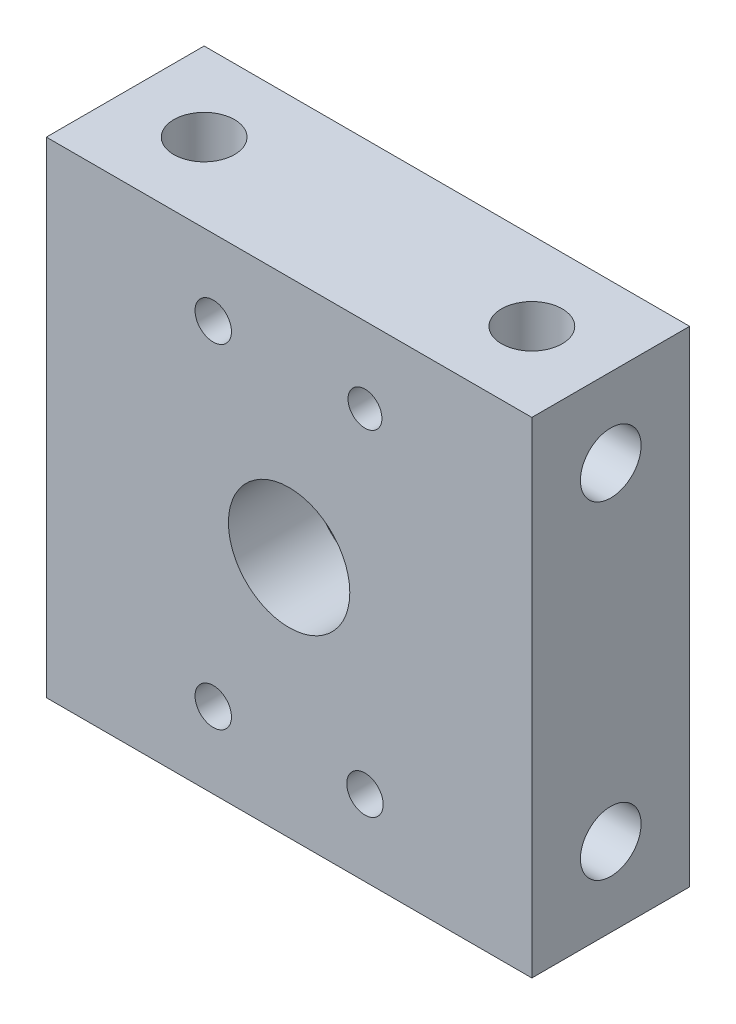
from build123d import *

# Parameters (mm, degrees)
SKETCH1_W           = 40
SKETCH1_H           = 40
SKETCH1_R           = 0.9
BOSS_EXTRUDE1_DEPTH = 6
SKETCH11_W          = 40
SKETCH11_H          = 40
SKETCH11_R          = 5
BOSS_EXTRUDE6_DEPTH = 7
SKETCH13_R          = 1.5
SKETCH13_R_2        = 1.395390764
CUT_EXTRUDE5_DEPTH  = 27
SKETCH13_3_R        = 3
SKETCH13_3_R_2      = 1.5
CUT_EXTRUDE6_DEPTH  = 3
SKETCH15_R          = 2.5
CUT_EXTRUDE9_DEPTH  = 5
CIRPATTERN4_COUNT   = 4


with BuildPart() as part:
    # Sketch1 → Boss-Extrude1 (new body)
    with BuildSketch(Plane(origin=(0, 0, 0), x_dir=(0, 1, 0), z_dir=(0, 0, 1))):
        Rectangle(SKETCH1_W, SKETCH1_H)
        Polygon((-5, -5), (-5, 5), (5, 5), (5, -5), (5, -13), (-5, -13), (-8, -13), (-8, -5), align=None, mode=Mode.SUBTRACT)
        with Locations((10.5, 0)):
            Circle(SKETCH1_R, mode=Mode.SUBTRACT)
        with Locations((-10.5, 0)):
            Circle(SKETCH1_R, mode=Mode.SUBTRACT)
        with Locations((-10.5, 12.5)):
            Circle(SKETCH1_R, mode=Mode.SUBTRACT)
        with Locations((10.5, 12.5)):
            Circle(SKETCH1_R, mode=Mode.SUBTRACT)
    extrude(amount=BOSS_EXTRUDE1_DEPTH)

    # Sketch11 → Boss-Extrude6 (add)
    with BuildSketch(Plane.XY.offset(6)):
        Rectangle(SKETCH11_W, SKETCH11_H)
        Circle(SKETCH11_R, mode=Mode.SUBTRACT)
    extrude(amount=BOSS_EXTRUDE6_DEPTH)

    # Sketch13 → Cut-Extrude5 (cut)
    with BuildSketch(Plane(origin=(0, 0, 0), x_dir=(1, 0, 0), z_dir=(0, 0, -1))):
        with Locations((-6.25, 13.75)):
            Circle(SKETCH13_R)
        with Locations((6.25, 13.75)):
            Circle(SKETCH13_R)
        with Locations((-6.25, -13.75)):
            Circle(SKETCH13_R)
        with Locations((6.25, -13.75)):
            Circle(SKETCH13_R_2)
    extrude(amount=-CUT_EXTRUDE5_DEPTH, mode=Mode.SUBTRACT)

    # Sketch13<3> → Cut-Extrude6 (cut)
    # profile 1 of 4: a face of its own
    with BuildSketch(Plane(origin=(0, 0, 0), x_dir=(1, 0, 0), z_dir=(0, 0, -1))):
        with Locations((6.25, -13.75)):
            Circle(SKETCH13_3_R)
    # profile 2 of 4: a face of its own
    with BuildSketch(Plane(origin=(0, 0, 0), x_dir=(1, 0, 0), z_dir=(0, 0, -1))):
        with Locations((-6.25, 13.75)):
            Circle(SKETCH13_3_R)
        with Locations((-6.25, 13.75)):
            Circle(SKETCH13_3_R_2, mode=Mode.SUBTRACT)
    # profile 3 of 4: a face of its own
    with BuildSketch(Plane(origin=(0, 0, 0), x_dir=(1, 0, 0), z_dir=(0, 0, -1))):
        with Locations((6.25, 13.75)):
            Circle(SKETCH13_3_R)
        with Locations((6.25, 13.75)):
            Circle(SKETCH13_3_R_2, mode=Mode.SUBTRACT)
    # profile 4 of 4: a face of its own
    with BuildSketch(Plane(origin=(0, 0, 0), x_dir=(1, 0, 0), z_dir=(0, 0, -1))):
        with Locations((-6.25, -13.75)):
            Circle(SKETCH13_3_R)
        with Locations((-6.25, -13.75)):
            Circle(SKETCH13_3_R_2, mode=Mode.SUBTRACT)
    extrude(amount=-CUT_EXTRUDE6_DEPTH, mode=Mode.SUBTRACT)

    # Sketch15 → Cut-Extrude9 (cut)
    with BuildSketch(Plane(origin=(0, 20, 0), x_dir=(-1, 0, 0), z_dir=(0, 1, 0))):
        with Locations((-13.5, 6.5)):
            Circle(SKETCH15_R)
        with Locations((13.5, 6.5)):
            Circle(SKETCH15_R)
    cut_extrude9 = extrude(amount=-CUT_EXTRUDE9_DEPTH, mode=Mode.SUBTRACT)

    # CirPattern4: Cut-Extrude9 ×4 about axis
    cirpattern4_axis = Axis((0, 0, 13), (0, 0, 1))
    for i in range(1, CIRPATTERN4_COUNT):
        add(cut_extrude9.rotate(cirpattern4_axis, i * 360 / CIRPATTERN4_COUNT), mode=Mode.SUBTRACT)


solid = part.part
